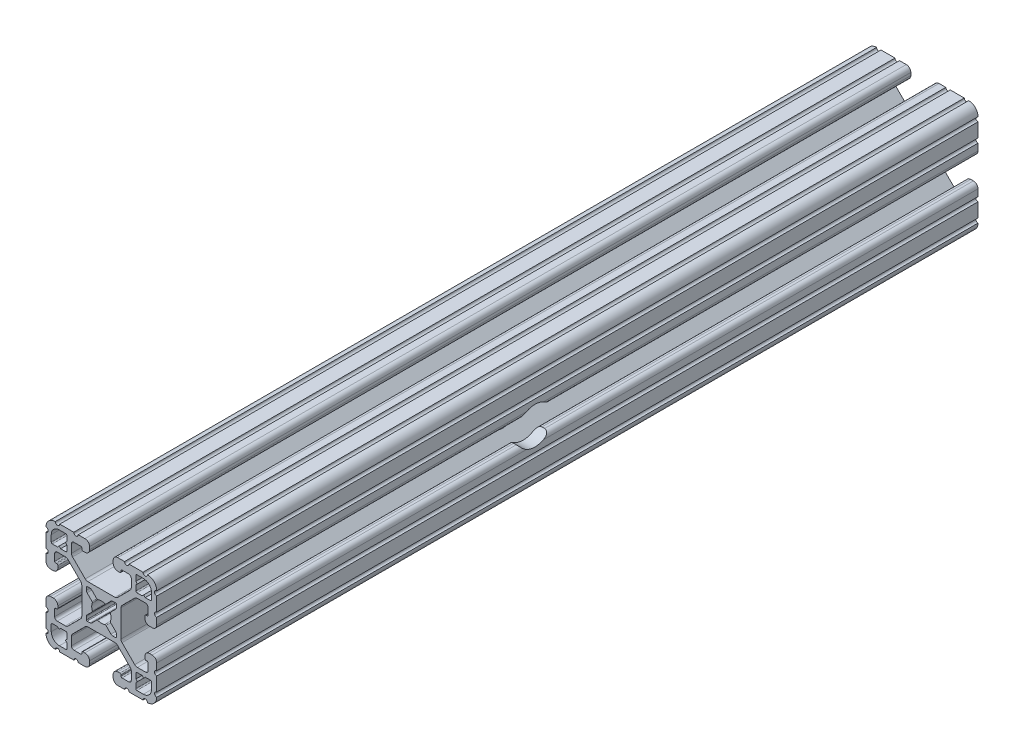
from build123d import *

# Parameters (mm, degrees)
BOSS_EXTRUDE1_DEPTH = 282.575
SKETCH2_R           = 6.35
CUT_EXTRUDE1_DEPTH  = 2323.966592157


with BuildPart() as part:
    # Sketch1 → Boss-Extrude1 (new body)
    with BuildSketch(Plane(origin=(0, 0, -2322.576), x_dir=(-1, 0, 0), z_dir=(0, 0, -1))):
        with BuildLine():
            Line((19.05, -14.325600033), (19.05, -9.4996))
            ThreePointArc((19.05, -9.4996), (18.288, -8.7376), (19.05, -7.9756))
            Line((19.05, -7.9756), (19.05, -5.6388))
            ThreePointArc((19.05, -5.6388), (18.588751759, -4.525248241), (17.4752, -4.064))
            Line((17.4752, -4.064), (16.5608, -4.064))
            ThreePointArc((16.5608, -4.064), (15.447248241, -4.525248241), (14.986, -5.6388))
            Line((14.986, -5.6388), (14.986, -6.350014224))
            ThreePointArc((14.986, -6.350014224), (15.097592316, -6.619421908), (15.367, -6.731014224))
            Line((15.367, -6.731014224), (15.6972, -6.731014224))
            ThreePointArc((15.6972, -6.731014224), (15.966607684, -6.84260654), (16.0782, -7.112014224))
            Line((16.0782, -7.112014224), (16.0782, -9.398014224))
            ThreePointArc((16.0782, -9.398014224), (15.817817928, -10.026632152), (15.1892, -10.287014224))
            Line((15.1892, -10.287014224), (12.375630013, -10.287014224))
            ThreePointArc((12.375630013, -10.287014224), (11.889622054, -10.19034123), (11.477604401, -9.915039836))
            Line((11.477604401, -9.915039836), (7.115699788, -5.553135223))
            ThreePointArc((7.115699788, -5.553135223), (6.840398394, -5.14111757), (6.7437254, -4.655109611))
            Line((6.7437254, -4.655109611), (6.7437254, 4.655109611))
            ThreePointArc((6.7437254, 4.655109611), (6.840398394, 5.14111757), (7.115699788, 5.553135223))
            Line((7.115699788, 5.553135223), (11.477604401, 9.915039836))
            ThreePointArc((11.477604401, 9.915039836), (11.889622054, 10.19034123), (12.375630013, 10.287014224))
            Line((12.375630013, 10.287014224), (15.1892, 10.287014224))
            ThreePointArc((15.1892, 10.287014224), (15.817817928, 10.026632152), (16.0782, 9.398014224))
            Line((16.0782, 9.398014224), (16.0782, 7.112014224))
            ThreePointArc((16.0782, 7.112014224), (15.966607684, 6.84260654), (15.6972, 6.731014224))
            Line((15.6972, 6.731014224), (15.367, 6.731014224))
            ThreePointArc((15.367, 6.731014224), (15.097592316, 6.619421908), (14.986, 6.350014224))
            Line((14.986, 6.350014224), (14.986, 5.6388))
            ThreePointArc((14.986, 5.6388), (15.447248241, 4.525248241), (16.5608, 4.064))
            Line((16.5608, 4.064), (17.4752, 4.064))
            ThreePointArc((17.4752, 4.064), (18.588751759, 4.525248241), (19.05, 5.6388))
            Line((19.05, 5.6388), (19.05, 7.9756))
            ThreePointArc((19.05, 7.9756), (18.288, 8.7376), (19.05, 9.4996))
            Line((19.05, 9.4996), (19.05, 14.325599984))
            ThreePointArc((19.05, 14.325599984), (18.287999986, 15.087549208), (19.049898416, 15.849600009))
            ThreePointArc((19.049898416, 15.849600009), (18.120064036, 18.120064058), (15.849599977, 19.049898414))
            ThreePointArc((15.849599977, 19.049898414), (15.0875492, 18.288000035), (14.325600017, 19.050000016))
            Line((14.325600017, 19.050000016), (9.499600001, 19.050000016))
            ThreePointArc((9.499600001, 19.050000016), (8.737600001, 18.288000016), (7.975600001, 19.050000016))
            Line((7.975600001, 19.050000016), (5.638800016, 19.050000016))
            ThreePointArc((5.638800016, 19.050000016), (4.525248257, 18.588751775), (4.064000016, 17.475200016))
            Line((4.064000016, 17.475200016), (4.064000016, 16.5608))
            ThreePointArc((4.064000016, 16.5608), (4.525248257, 15.447248241), (5.638800016, 14.986))
            Line((5.638800016, 14.986), (6.350014224, 14.986))
            ThreePointArc((6.350014224, 14.986), (6.619421908, 15.097592316), (6.731014224, 15.367))
            Line((6.731014224, 15.367), (6.731014224, 15.6972))
            ThreePointArc((6.731014224, 15.6972), (6.84260654, 15.966607684), (7.112014224, 16.0782))
            Line((7.112014224, 16.0782), (9.398014224, 16.0782))
            ThreePointArc((9.398014224, 16.0782), (10.026632152, 15.817817928), (10.287014224, 15.1892))
            Line((10.287014224, 15.1892), (10.287014224, 12.375630013))
            ThreePointArc((10.287014224, 12.375630013), (10.19034123, 11.889622054), (9.915039836, 11.477604401))
            Line((9.915039836, 11.477604401), (5.553135223, 7.115699788))
            ThreePointArc((5.553135223, 7.115699788), (5.14111757, 6.840398394), (4.655109611, 6.7437254))
            Line((4.655109611, 6.7437254), (-4.655109611, 6.7437254))
            ThreePointArc((-4.655109611, 6.7437254), (-5.14111757, 6.840398394), (-5.553135223, 7.115699788))
            Line((-5.553135223, 7.115699788), (-9.915039836, 11.477604401))
            ThreePointArc((-9.915039836, 11.477604401), (-10.19034123, 11.889622054), (-10.287014224, 12.375630013))
            Line((-10.287014224, 12.375630013), (-10.287014224, 15.1892))
            ThreePointArc((-10.287014224, 15.1892), (-10.026632152, 15.817817928), (-9.398014224, 16.0782))
            Line((-9.398014224, 16.0782), (-7.112014224, 16.0782))
            ThreePointArc((-7.112014224, 16.0782), (-6.84260654, 15.966607684), (-6.731014224, 15.6972))
            Line((-6.731014224, 15.6972), (-6.731014224, 15.367))
            ThreePointArc((-6.731014224, 15.367), (-6.619421908, 15.097592316), (-6.350014224, 14.986))
            Line((-6.350014224, 14.986), (-5.638799984, 14.986))
            ThreePointArc((-5.638799984, 14.986), (-4.525248225, 15.447248241), (-4.063999984, 16.5608))
            Line((-4.063999984, 16.5608), (-4.063999984, 17.475200016))
            ThreePointArc((-4.063999984, 17.475200016), (-4.525248225, 18.588751775), (-5.638799984, 19.050000016))
            Line((-5.638799984, 19.050000016), (-7.975599999, 19.050000016))
            ThreePointArc((-7.975599999, 19.050000016), (-8.737599999, 18.288000016), (-9.499599999, 19.050000016))
            Line((-9.499599999, 19.050000016), (-14.325599999, 19.050000016))
            ThreePointArc((-14.325599999, 19.050000016), (-15.087549199, 18.288000018), (-15.849599993, 19.049898416))
            ThreePointArc((-15.849599993, 19.049898416), (-18.120064042, 18.120064036), (-19.049898398, 15.849599976))
            ThreePointArc((-19.049898398, 15.849599976), (-18.288000019, 15.087549199), (-19.05, 14.325600017))
            Line((-19.05, 14.325600017), (-19.05, 9.4996))
            ThreePointArc((-19.05, 9.4996), (-18.288, 8.7376), (-19.05, 7.9756))
            Line((-19.05, 7.9756), (-19.05, 5.6388))
            ThreePointArc((-19.05, 5.6388), (-18.588751759, 4.525248241), (-17.4752, 4.064))
            Line((-17.4752, 4.064), (-16.5608, 4.064))
            ThreePointArc((-16.5608, 4.064), (-15.447248241, 4.525248241), (-14.986, 5.6388))
            Line((-14.986, 5.6388), (-14.986, 6.350014224))
            ThreePointArc((-14.986, 6.350014224), (-15.097592316, 6.619421908), (-15.367, 6.731014224))
            Line((-15.367, 6.731014224), (-15.6972, 6.731014224))
            ThreePointArc((-15.6972, 6.731014224), (-15.966607684, 6.84260654), (-16.0782, 7.112014224))
            Line((-16.0782, 7.112014224), (-16.0782, 9.398014224))
            ThreePointArc((-16.0782, 9.398014224), (-15.817817928, 10.026632152), (-15.1892, 10.287014224))
            Line((-15.1892, 10.287014224), (-12.375630013, 10.287014224))
            ThreePointArc((-12.375630013, 10.287014224), (-11.889622054, 10.19034123), (-11.477604401, 9.915039836))
            Line((-11.477604401, 9.915039836), (-7.115699788, 5.553135223))
            ThreePointArc((-7.115699788, 5.553135223), (-6.840398394, 5.14111757), (-6.7437254, 4.655109611))
            Line((-6.7437254, 4.655109611), (-6.7437254, -4.655109611))
            ThreePointArc((-6.7437254, -4.655109611), (-6.840398394, -5.14111757), (-7.115699788, -5.553135223))
            Line((-7.115699788, -5.553135223), (-11.477604401, -9.915039836))
            ThreePointArc((-11.477604401, -9.915039836), (-11.889622054, -10.19034123), (-12.375630013, -10.287014224))
            Line((-12.375630013, -10.287014224), (-15.1892, -10.287014224))
            ThreePointArc((-15.1892, -10.287014224), (-15.817817928, -10.026632152), (-16.0782, -9.398014224))
            Line((-16.0782, -9.398014224), (-16.0782, -7.112014224))
            ThreePointArc((-16.0782, -7.112014224), (-15.966607684, -6.84260654), (-15.6972, -6.731014224))
            Line((-15.6972, -6.731014224), (-15.367, -6.731014224))
            ThreePointArc((-15.367, -6.731014224), (-15.097592316, -6.619421908), (-14.986, -6.350014224))
            Line((-14.986, -6.350014224), (-14.986, -5.6388))
            ThreePointArc((-14.986, -5.6388), (-15.447248241, -4.525248241), (-16.5608, -4.064))
            Line((-16.5608, -4.064), (-17.4752, -4.064))
            ThreePointArc((-17.4752, -4.064), (-18.588751759, -4.525248241), (-19.05, -5.6388))
            Line((-19.05, -5.6388), (-19.05, -7.9756))
            ThreePointArc((-19.05, -7.9756), (-18.288, -8.7376), (-19.05, -9.4996))
            Line((-19.05, -9.4996), (-19.05, -14.3256))
            ThreePointArc((-19.05, -14.3256), (-18.288000002, -15.0875492), (-19.0498984, -15.849599993))
            ThreePointArc((-19.0498984, -15.849599993), (-18.120064019, -18.120064043), (-15.84959996, -19.049898399))
            ThreePointArc((-15.84959996, -19.049898399), (-15.087549183, -18.288000019), (-14.325600001, -19.050000001))
            Line((-14.325600001, -19.050000001), (-9.499599984, -19.050000001))
            ThreePointArc((-9.499599984, -19.050000001), (-8.737599984, -18.288000001), (-7.975599984, -19.050000001))
            Line((-7.975599984, -19.050000001), (-5.638799984, -19.050000001))
            ThreePointArc((-5.638799984, -19.050000001), (-4.525248225, -18.58875176), (-4.063999984, -17.475200001))
            Line((-4.063999984, -17.475200001), (-4.063999984, -16.5608))
            ThreePointArc((-4.063999984, -16.5608), (-4.525248225, -15.447248241), (-5.638799984, -14.986))
            Line((-5.638799984, -14.986), (-6.350014224, -14.986))
            ThreePointArc((-6.350014224, -14.986), (-6.619421908, -15.097592316), (-6.731014224, -15.367))
            Line((-6.731014224, -15.367), (-6.731014224, -15.6972))
            ThreePointArc((-6.731014224, -15.6972), (-6.84260654, -15.966607684), (-7.112014224, -16.0782))
            Line((-7.112014224, -16.0782), (-9.398014224, -16.0782))
            ThreePointArc((-9.398014224, -16.0782), (-10.026632152, -15.817817928), (-10.287014224, -15.1892))
            Line((-10.287014224, -15.1892), (-10.287014224, -12.375630013))
            ThreePointArc((-10.287014224, -12.375630013), (-10.19034123, -11.889622054), (-9.915039836, -11.477604401))
            Line((-9.915039836, -11.477604401), (-5.553135223, -7.115699788))
            ThreePointArc((-5.553135223, -7.115699788), (-5.14111757, -6.840398394), (-4.655109611, -6.7437254))
            Line((-4.655109611, -6.7437254), (4.655109611, -6.7437254))
            ThreePointArc((4.655109611, -6.7437254), (5.14111757, -6.840398394), (5.553135223, -7.115699788))
            Line((5.553135223, -7.115699788), (9.915039836, -11.477604401))
            ThreePointArc((9.915039836, -11.477604401), (10.19034123, -11.889622054), (10.287014224, -12.375630013))
            Line((10.287014224, -12.375630013), (10.287014224, -15.1892))
            ThreePointArc((10.287014224, -15.1892), (10.026632152, -15.817817928), (9.398014224, -16.0782))
            Line((9.398014224, -16.0782), (7.112014224, -16.0782))
            ThreePointArc((7.112014224, -16.0782), (6.84260654, -15.966607684), (6.731014224, -15.6972))
            Line((6.731014224, -15.6972), (6.731014224, -15.367))
            ThreePointArc((6.731014224, -15.367), (6.619421908, -15.097592316), (6.350014224, -14.986))
            Line((6.350014224, -14.986), (5.638800016, -14.986))
            ThreePointArc((5.638800016, -14.986), (4.525248257, -15.447248241), (4.064000016, -16.5608))
            Line((4.064000016, -16.5608), (4.064000016, -17.475200001))
            ThreePointArc((4.064000016, -17.475200001), (4.525248257, -18.58875176), (5.638800016, -19.050000001))
            Line((5.638800016, -19.050000001), (7.975600016, -19.050000001))
            ThreePointArc((7.975600016, -19.050000001), (8.737600016, -18.288000001), (9.499600016, -19.050000001))
            Line((9.499600016, -19.050000001), (14.325600016, -19.050000001))
            ThreePointArc((14.325600016, -19.050000001), (15.087549216, -18.288000002), (15.849600009, -19.0498984))
            ThreePointArc((15.849600009, -19.0498984), (18.120064059, -18.12006402), (19.049898415, -15.849599961))
            ThreePointArc((19.049898415, -15.849599961), (18.288000034, -15.087549207), (19.05, -14.325600033))
        make_face()
        with BuildLine():
            Line((17.246614224, 14.452614224), (17.246614224, 12.242814224))
            ThreePointArc((17.246614224, 12.242814224), (17.135021908, 11.97340654), (16.865614224, 11.861814224))
            Line((16.865614224, 11.861814224), (15.092694224, 11.861814224))
            Line((15.092694224, 11.861814224), (14.554214224, 12.400294224))
            Line((14.554214224, 12.400294224), (14.015734224, 11.861814224))
            Line((14.015734224, 11.861814224), (12.242814224, 11.861814224))
            ThreePointArc((12.242814224, 11.861814224), (11.97340654, 11.97340654), (11.861814224, 12.242814224))
            Line((11.861814224, 12.242814224), (11.861814224, 14.015734224))
            Line((11.861814224, 14.015734224), (12.400294224, 14.554214224))
            Line((12.400294224, 14.554214224), (11.861814224, 15.092694224))
            Line((11.861814224, 15.092694224), (11.861814224, 16.865614224))
            ThreePointArc((11.861814224, 16.865614224), (11.97340654, 17.135021908), (12.242814224, 17.246614224))
            Line((12.242814224, 17.246614224), (14.452614224, 17.246614224))
            ThreePointArc((14.452614224, 17.246614224), (16.428270571, 16.428270571), (17.246614224, 14.452614224))
        make_face(mode=Mode.SUBTRACT)
        with BuildLine():
            Line((17.246614224, -12.242814224), (17.246614224, -14.452614224))
            ThreePointArc((17.246614224, -14.452614224), (16.428270571, -16.428270571), (14.452614224, -17.246614224))
            Line((14.452614224, -17.246614224), (12.242814224, -17.246614224))
            ThreePointArc((12.242814224, -17.246614224), (11.97340654, -17.135021908), (11.861814224, -16.865614224))
            Line((11.861814224, -16.865614224), (11.861814224, -15.092694224))
            Line((11.861814224, -15.092694224), (12.400294224, -14.554214224))
            Line((12.400294224, -14.554214224), (11.861814224, -14.015734224))
            Line((11.861814224, -14.015734224), (11.861814224, -12.242814224))
            ThreePointArc((11.861814224, -12.242814224), (11.97340654, -11.97340654), (12.242814224, -11.861814224))
            Line((12.242814224, -11.861814224), (14.015734224, -11.861814224))
            Line((14.015734224, -11.861814224), (14.554214224, -12.400294224))
            Line((14.554214224, -12.400294224), (15.092694224, -11.861814224))
            Line((15.092694224, -11.861814224), (16.865614224, -11.861814224))
            ThreePointArc((16.865614224, -11.861814224), (17.135021908, -11.97340654), (17.246614224, -12.242814224))
        make_face(mode=Mode.SUBTRACT)
        with BuildLine():
            Line((5.1689, -3.920689755), (5.1689, -4.9149))
            ThreePointArc((5.1689, -4.9149), (5.094505122, -5.094505122), (4.9149, -5.1689))
            Line((4.9149, -5.1689), (3.920689755, -5.1689))
            ThreePointArc((3.920689755, -5.1689), (3.580484184, -5.101228904), (3.292071827, -4.908517928))
            Line((3.292071827, -4.908517928), (1.582347442, -3.198793543))
            ThreePointArc((1.582347442, -3.198793543), (1.393016011, -3.095711236), (1.178048687, -3.111879183))
            ThreePointArc((1.178048687, -3.111879183), (0, -3.3274), (-1.178048687, -3.111879183))
            ThreePointArc((-1.178048687, -3.111879183), (-1.393016011, -3.095711236), (-1.582347442, -3.198793543))
            Line((-1.582347442, -3.198793543), (-3.292071827, -4.908517928))
            ThreePointArc((-3.292071827, -4.908517928), (-3.580484184, -5.101228904), (-3.920689755, -5.1689))
            Line((-3.920689755, -5.1689), (-4.9149, -5.1689))
            ThreePointArc((-4.9149, -5.1689), (-5.094505122, -5.094505122), (-5.1689, -4.9149))
            Line((-5.1689, -4.9149), (-5.1689, -3.920689755))
            ThreePointArc((-5.1689, -3.920689755), (-5.101228904, -3.580484184), (-4.908517928, -3.292071827))
            Line((-4.908517928, -3.292071827), (-3.198793543, -1.582347442))
            ThreePointArc((-3.198793543, -1.582347442), (-3.095711236, -1.393016011), (-3.111879183, -1.178048687))
            ThreePointArc((-3.111879183, -1.178048687), (-3.3274, 0), (-3.111879183, 1.178048687))
            ThreePointArc((-3.111879183, 1.178048687), (-3.095711236, 1.393016011), (-3.198793543, 1.582347442))
            Line((-3.198793543, 1.582347442), (-4.908517928, 3.292071827))
            ThreePointArc((-4.908517928, 3.292071827), (-5.101228904, 3.580484184), (-5.1689, 3.920689755))
            Line((-5.1689, 3.920689755), (-5.1689, 4.9149))
            ThreePointArc((-5.1689, 4.9149), (-5.094505122, 5.094505122), (-4.9149, 5.1689))
            Line((-4.9149, 5.1689), (-3.920689755, 5.1689))
            ThreePointArc((-3.920689755, 5.1689), (-3.580484184, 5.101228904), (-3.292071827, 4.908517928))
            Line((-3.292071827, 4.908517928), (-1.582347442, 3.198793543))
            ThreePointArc((-1.582347442, 3.198793543), (-1.393016011, 3.095711236), (-1.178048687, 3.111879183))
            ThreePointArc((-1.178048687, 3.111879183), (0, 3.3274), (1.178048687, 3.111879183))
            ThreePointArc((1.178048687, 3.111879183), (1.393016011, 3.095711236), (1.582347442, 3.198793543))
            Line((1.582347442, 3.198793543), (3.292071827, 4.908517928))
            ThreePointArc((3.292071827, 4.908517928), (3.580484184, 5.101228904), (3.920689755, 5.1689))
            Line((3.920689755, 5.1689), (4.9149, 5.1689))
            ThreePointArc((4.9149, 5.1689), (5.094505122, 5.094505122), (5.1689, 4.9149))
            Line((5.1689, 4.9149), (5.1689, 3.920689755))
            ThreePointArc((5.1689, 3.920689755), (5.101228904, 3.580484184), (4.908517928, 3.292071827))
            Line((4.908517928, 3.292071827), (3.198793543, 1.582347442))
            ThreePointArc((3.198793543, 1.582347442), (3.095711236, 1.393016011), (3.111879183, 1.178048687))
            ThreePointArc((3.111879183, 1.178048687), (3.3274, 0), (3.111879183, -1.178048687))
            ThreePointArc((3.111879183, -1.178048687), (3.095711236, -1.393016011), (3.198793543, -1.582347442))
            Line((3.198793543, -1.582347442), (4.908517928, -3.292071827))
            ThreePointArc((4.908517928, -3.292071827), (5.101228904, -3.580484184), (5.1689, -3.920689755))
        make_face(mode=Mode.SUBTRACT)
        with BuildLine():
            Line((-11.861814224, -12.242814224), (-11.861814224, -14.015734224))
            Line((-11.861814224, -14.015734224), (-12.400294224, -14.554214224))
            Line((-12.400294224, -14.554214224), (-11.861814224, -15.092694224))
            Line((-11.861814224, -15.092694224), (-11.861814224, -16.865614224))
            ThreePointArc((-11.861814224, -16.865614224), (-11.97340654, -17.135021908), (-12.242814224, -17.246614224))
            Line((-12.242814224, -17.246614224), (-14.452614224, -17.246614224))
            ThreePointArc((-14.452614224, -17.246614224), (-16.428270571, -16.428270571), (-17.246614224, -14.452614224))
            Line((-17.246614224, -14.452614224), (-17.246614224, -12.242814224))
            ThreePointArc((-17.246614224, -12.242814224), (-17.135021908, -11.97340654), (-16.865614224, -11.861814224))
            Line((-16.865614224, -11.861814224), (-15.092694224, -11.861814224))
            Line((-15.092694224, -11.861814224), (-14.554214224, -12.400294224))
            Line((-14.554214224, -12.400294224), (-14.015734224, -11.861814224))
            Line((-14.015734224, -11.861814224), (-12.242814224, -11.861814224))
            ThreePointArc((-12.242814224, -11.861814224), (-11.97340654, -11.97340654), (-11.861814224, -12.242814224))
        make_face(mode=Mode.SUBTRACT)
        with BuildLine():
            Line((-11.861814224, 16.865614224), (-11.861814224, 15.092694224))
            Line((-11.861814224, 15.092694224), (-12.400294224, 14.554214224))
            Line((-12.400294224, 14.554214224), (-11.861814224, 14.015734224))
            Line((-11.861814224, 14.015734224), (-11.861814224, 12.242814224))
            ThreePointArc((-11.861814224, 12.242814224), (-11.97340654, 11.97340654), (-12.242814224, 11.861814224))
            Line((-12.242814224, 11.861814224), (-14.015734224, 11.861814224))
            Line((-14.015734224, 11.861814224), (-14.554214224, 12.400294224))
            Line((-14.554214224, 12.400294224), (-15.092694224, 11.861814224))
            Line((-15.092694224, 11.861814224), (-16.865614224, 11.861814224))
            ThreePointArc((-16.865614224, 11.861814224), (-17.135021908, 11.97340654), (-17.246614224, 12.242814224))
            Line((-17.246614224, 12.242814224), (-17.246614224, 14.452614224))
            ThreePointArc((-17.246614224, 14.452614224), (-16.428270571, 16.428270571), (-14.452614224, 17.246614224))
            Line((-14.452614224, 17.246614224), (-12.242814224, 17.246614224))
            ThreePointArc((-12.242814224, 17.246614224), (-11.97340654, 17.135021908), (-11.861814224, 16.865614224))
        make_face(mode=Mode.SUBTRACT)
    extrude(amount=-BOSS_EXTRUDE1_DEPTH)

    # Sketch2 → Cut-Extrude1 (cut, through all)
    with BuildSketch(Plane(origin=(19.05, 0, 0), x_dir=(0, 0, -1), z_dir=(1, 0, 0))):
        with Locations((2170.176, 0)):
            Circle(SKETCH2_R)
    extrude(amount=-CUT_EXTRUDE1_DEPTH, mode=Mode.SUBTRACT)


solid = part.part
